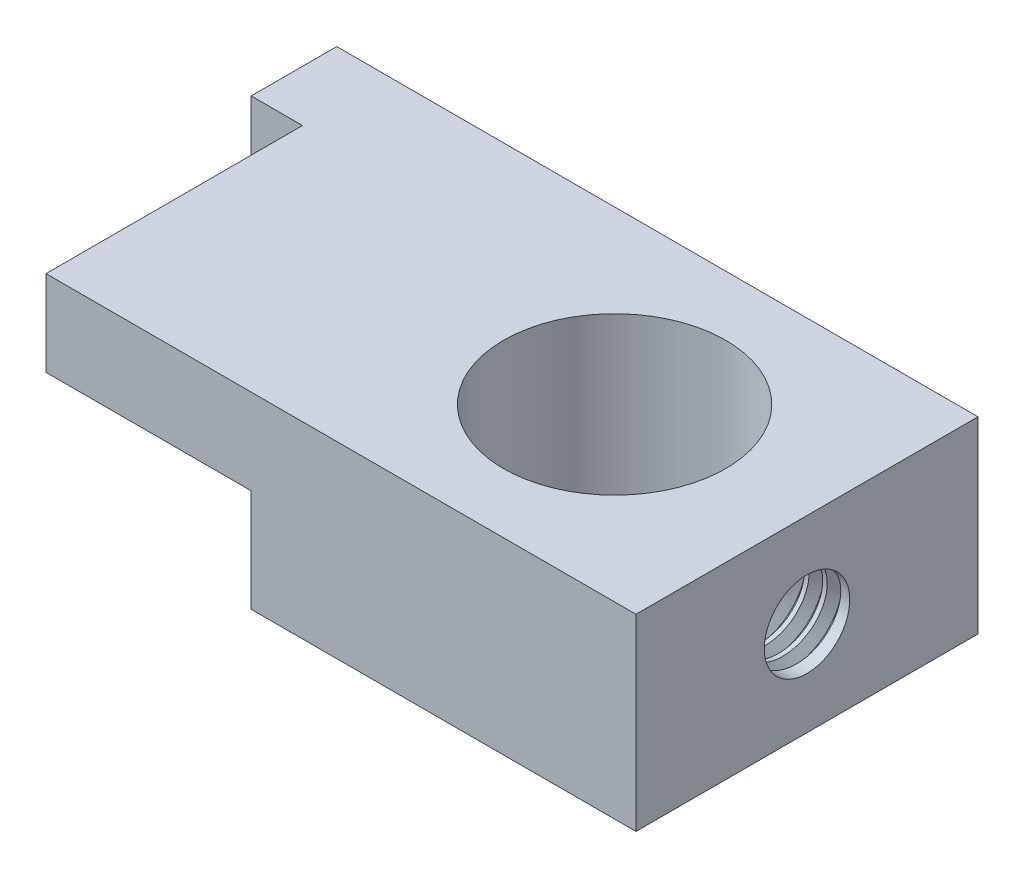
from build123d import *
from build123d.topology import SkipClean

# Parameters (mm, degrees)
SKETCH1_W           = 22.5
SKETCH1_H           = 11
BOSS_EXTRUDE1_DEPTH = 20
SKETCH3_R           = 6.5
CUT_EXTRUDE1_DEPTH  = 26
SKETCH4_R           = 2.5
CUT_EXTRUDE2_DEPTH  = 9
SKETCH6_W           = 5
SKETCH6_H           = 11
BOSS_EXTRUDE4_DEPTH = 15
THREAD1_PITCH       = 1.058333333
SKETCH7_W           = 15
SKETCH7_H           = 5
BOSS_EXTRUDE5_DEPTH = 12


with BuildPart() as part:
    # Sketch1 → Boss-Extrude1 (new body)
    with BuildSketch(Plane.XY):
        with Locations((-11.25, -5.5)):
            Rectangle(SKETCH1_W, SKETCH1_H)
    extrude(amount=BOSS_EXTRUDE1_DEPTH)

    # Sketch3 → Cut-Extrude1 (cut)
    with BuildSketch(Plane(origin=(0, 0, 0), x_dir=(1, 0, 0), z_dir=(0, 1, 0))):
        with Locations(Location((-11.25, -10, 0), (0, 0, 180))):
            Circle(SKETCH3_R)
    extrude(amount=-CUT_EXTRUDE1_DEPTH, mode=Mode.SUBTRACT)

    # Sketch4 → Cut-Extrude2 (cut)
    with BuildSketch(Plane(origin=(0, 0, 0), x_dir=(0, 0, -1), z_dir=(1, 0, 0))):
        with Locations(Location((-10, -5.5, 0), (0, 0, 90))):
            Circle(SKETCH4_R)
    extrude(amount=-CUT_EXTRUDE2_DEPTH, mode=Mode.SUBTRACT)

    # Sketch6 → Boss-Extrude4 (add)
    with BuildSketch(Plane.ZY.offset(22.5)):
        with Locations((2.5, -5.5)):
            Rectangle(SKETCH6_W, SKETCH6_H)
    extrude(amount=BOSS_EXTRUDE4_DEPTH)

    # Thread1: the profile of Thread Profile1 profile screwed along a right-hand helix of 5.669291 turns, 8 arcs to a turn; built about Z, then put on its axis
    with SkipClean():  # the faces are left unmerged after this step: merging them gives an invalid solid
        thread1_z = Axis((0, 0, 0), (0, 0, 1))
        thread1_corners = [(2.4997, 0, -0.000173205), (3.072839718, 0, 0.330729165), (3.072839718, 0, 0.463020832), (2.4997, 0, 0.793923202)]
        with BuildLine(mode=Mode.PRIVATE) as thread1_profile:
            Line(thread1_corners[0], thread1_corners[1])
            Line(thread1_corners[1], thread1_corners[2])
            Line(thread1_corners[2], thread1_corners[3])
            Line(thread1_corners[3], thread1_corners[0])
        thread1_cap = Face(thread1_profile.wire())
        thread1_turn_angles = [0, 22.5, 45, 67.5, 90, 112.5, 135, 157.5, 180, 202.5, 225, 247.5, 270, 292.5, 315, 337.5, 360]
        thread1_turn_weights = [1, 0.9238795325112867, 1, 0.9238795325112867, 1, 0.9238795325112867, 1, 0.9238795325112867, 1, 0.9238795325112867, 1, 0.9238795325112867, 1, 0.9238795325112867, 1, 0.9238795325112867, 1]
        thread1_turn_rails = [Edge.make_bspline([Vector(p[0], p[1], 0).rotate(thread1_z, thread1_turn_angles[k]) / thread1_turn_weights[k] + Vector(0, 0, p[2] + THREAD1_PITCH * thread1_turn_angles[k] / 360) for k in range(17)], [0, 0, 0, 1, 1, 2, 2, 3, 3, 4, 4, 5, 5, 6, 6, 7, 7, 8, 8, 8], 2, thread1_turn_weights) for p in thread1_corners]
        thread1_turn_sides = [Face.make_surface_from_curves(thread1_turn_rails[p[0]], thread1_turn_rails[p[1]]) for p in [(0, 1), (1, 2), (2, 3), (3, 0)]]
        thread1_last_angles = [1800, 1822.5, 1845, 1867.5, 1890, 1912.5, 1935, 1957.5, 1980, 2002.5, 2025, 2032.972440945, 2040.94488189]
        thread1_last_weights = [1, 0.9238795325112867, 1, 0.9238795325112867, 1, 0.9238795325112867, 1, 0.9238795325112867, 1, 0.9238795325112867, 1, 0.9903348959258105, 1]
        thread1_last_rails = [Edge.make_bspline([Vector(p[0], p[1], 0).rotate(thread1_z, thread1_last_angles[k]) / thread1_last_weights[k] + Vector(0, 0, p[2] + THREAD1_PITCH * thread1_last_angles[k] / 360) for k in range(13)], [0, 0, 0, 1, 1, 2, 2, 3, 3, 4, 4, 5, 5, 6, 6, 6], 2, thread1_last_weights) for p in thread1_corners]
        thread1_last_sides = [Face.make_surface_from_curves(thread1_last_rails[p[0]], thread1_last_rails[p[1]]) for p in [(0, 1), (1, 2), (2, 3), (3, 0)]]
        thread1 = Plane(origin=(0, -5.5, 10), x_dir=(0, 0, 1), z_dir=(-1, 0, 0)) * Solid(Shell([*[p.moved(Location((0, 0, THREAD1_PITCH * i))) for i in range(5) for p in thread1_turn_sides], *thread1_last_sides, thread1_cap, thread1_cap.rotate(thread1_z, 2040.94488189).moved(Location((0, 0, THREAD1_PITCH * 2040.94488189 / 360)))]))
        add(thread1, mode=Mode.SUBTRACT)

    # Sketch7 → Boss-Extrude5 (add)
    with SkipClean():  # the faces are left unmerged after this step: merging them gives an invalid solid
        with BuildSketch(Plane.ZY.offset(22.5)):
            with Locations((12.5, -2.5)):
                Rectangle(SKETCH7_W, SKETCH7_H)
        extrude(amount=BOSS_EXTRUDE5_DEPTH)


solid = part.part
